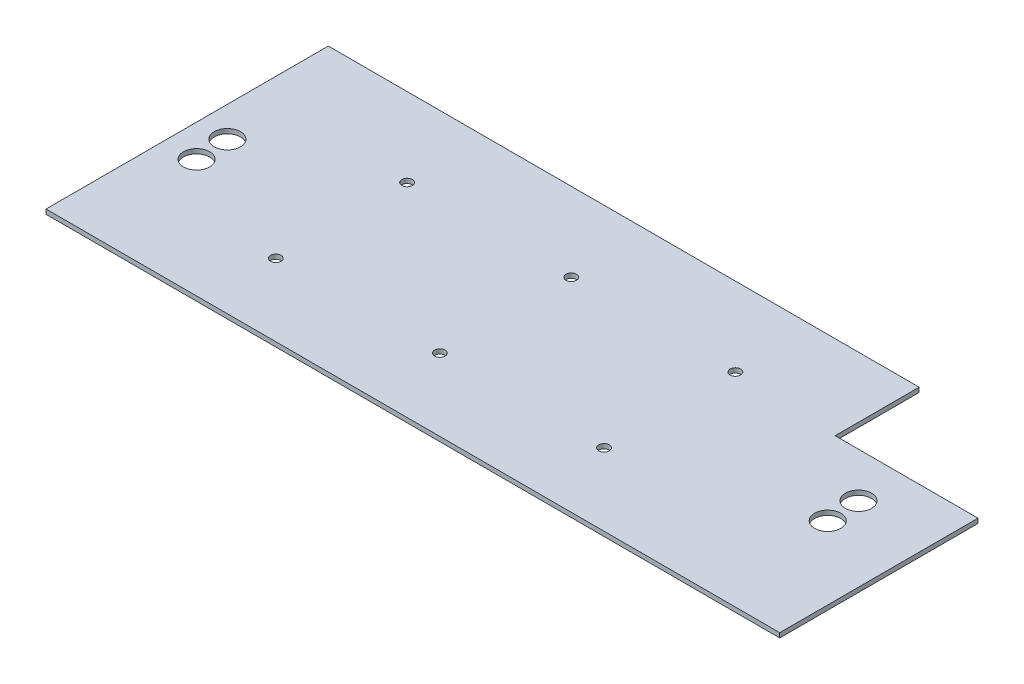
from build123d import *

# Parameters (mm, degrees)
BOSS_EXTRUDE1_DEPTH     = 3.5
CUT_EXTRUDE1_DEPTH      = 599.744260933
CUT_EXTRUDE1_DEPTH_BACK = 599.744260933
SKETCH2_R               = 4
SKETCH3_R               = 10
CUT_EXTRUDE2_DEPTH      = 10


with BuildPart() as part:
    # Sketch1 → Boss-Extrude1 (new body)
    with BuildSketch(Plane(origin=(0, 0, 0), x_dir=(1, 0, 0), z_dir=(0, 1, 0))):
        Polygon((0, 0), (0, 215), (450, 215), (450, 151), (558.8, 151), (558.8, 0), align=None)
    extrude(amount=BOSS_EXTRUDE1_DEPTH)

    # Sketch2 → Cut-Extrude1 (cut, two sides: drawn at the far end of the back side and taken through both)
    with BuildSketch(Plane(origin=(0, 3.5, 0), x_dir=(1, 0, 0), z_dir=(0, 1, 0)).offset(-CUT_EXTRUDE1_DEPTH_BACK)):
        with Locations((120, 155)):
            Circle(SKETCH2_R)
        with Locations((245, 155)):
            Circle(SKETCH2_R)
        with Locations((370, 155)):
            Circle(SKETCH2_R)
        with Locations((370, 55)):
            Circle(SKETCH2_R)
        with Locations((245, 55)):
            Circle(SKETCH2_R)
        with Locations((120, 55)):
            Circle(SKETCH2_R)
    extrude(amount=CUT_EXTRUDE1_DEPTH + CUT_EXTRUDE1_DEPTH_BACK, mode=Mode.SUBTRACT)

    # Sketch3 → Cut-Extrude2 (cut)
    with BuildSketch(Plane(origin=(0, 3.5, 0), x_dir=(1, 0, 0), z_dir=(0, 1, 0))):
        with Locations((501.8, 117)):
            Circle(SKETCH3_R)
        with Locations((503.315667462, 92.045987254)):
            Circle(SKETCH3_R)
        with Locations((23.0341, 115.10671)):
            Circle(SKETCH3_R)
        with Locations((24.554406399, 90.10671)):
            Circle(SKETCH3_R)
    extrude(amount=-CUT_EXTRUDE2_DEPTH, mode=Mode.SUBTRACT)


solid = part.part
